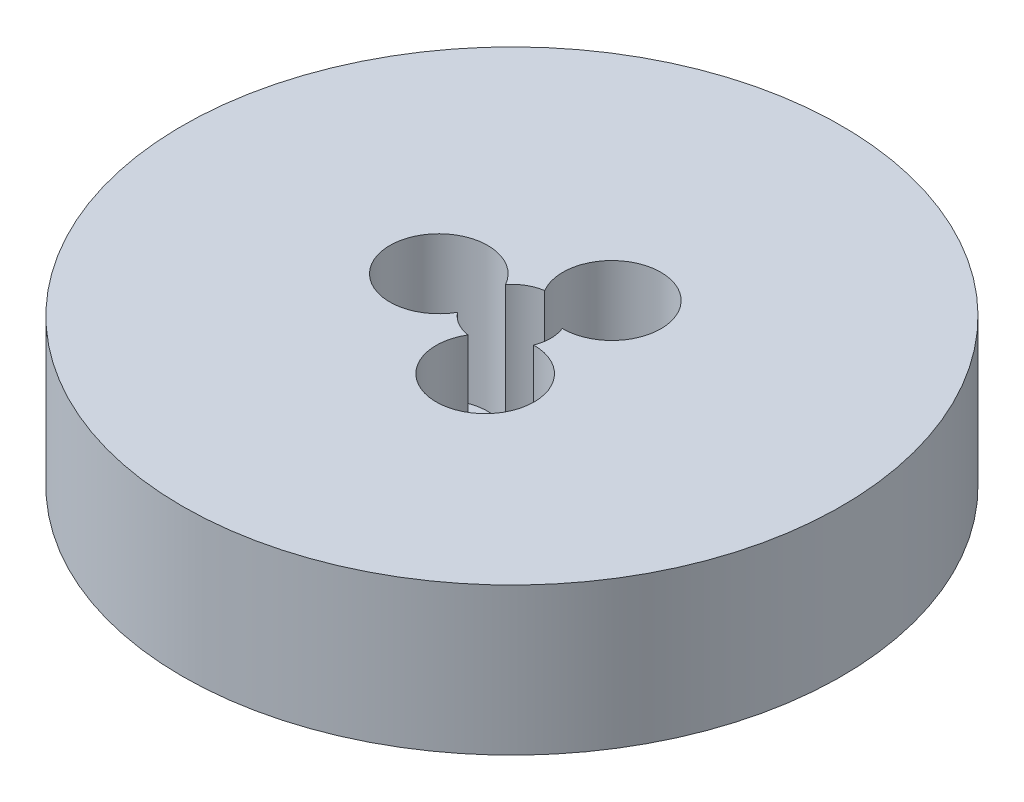
from build123d import *

# Parameters (mm, degrees)
SKETCH1_R           = 42.5
BOSS_EXTRUDE1_DEPTH = 19
SKETCH2_R           = 5
CUT_EXTRUDE1_DEPTH  = 64.035704168
SKETCH3_R           = 6.321900095
CUT_EXTRUDE2_DEPTH  = 18.526596059
CIRPATTERN1_COUNT   = 3


with BuildPart() as part:
    # Sketch1 → Boss-Extrude1 (new body)
    with BuildSketch(Plane(origin=(0, 0, 0), x_dir=(1, 0, 0), z_dir=(0, 1, 0))):
        Circle(SKETCH1_R)
    extrude(amount=BOSS_EXTRUDE1_DEPTH)

    # Sketch2 → Cut-Extrude1 (cut, through all)
    with BuildSketch(Plane(origin=(0, 0, 0), x_dir=(1, 0, 0), z_dir=(0, 1, 0))):
        Circle(SKETCH2_R)
    extrude(amount=CUT_EXTRUDE1_DEPTH, mode=Mode.SUBTRACT)

    # Sketch3 → Cut-Extrude2 (cut)
    with BuildSketch(Plane(origin=(0, 19, 0), x_dir=(1, 0, 0), z_dir=(0, 1, 0))):
        with Locations((-9.432061315, 0)):
            Circle(SKETCH3_R)
    cut_extrude2 = extrude(amount=-CUT_EXTRUDE2_DEPTH, mode=Mode.SUBTRACT)

    # CirPattern1: Cut-Extrude2 ×3 about axis
    cirpattern1_axis = Axis((0, 0, 0), (0, 1, 0))
    for i in range(1, CIRPATTERN1_COUNT):
        add(cut_extrude2.rotate(cirpattern1_axis, i * 360 / CIRPATTERN1_COUNT), mode=Mode.SUBTRACT)


solid = part.part
